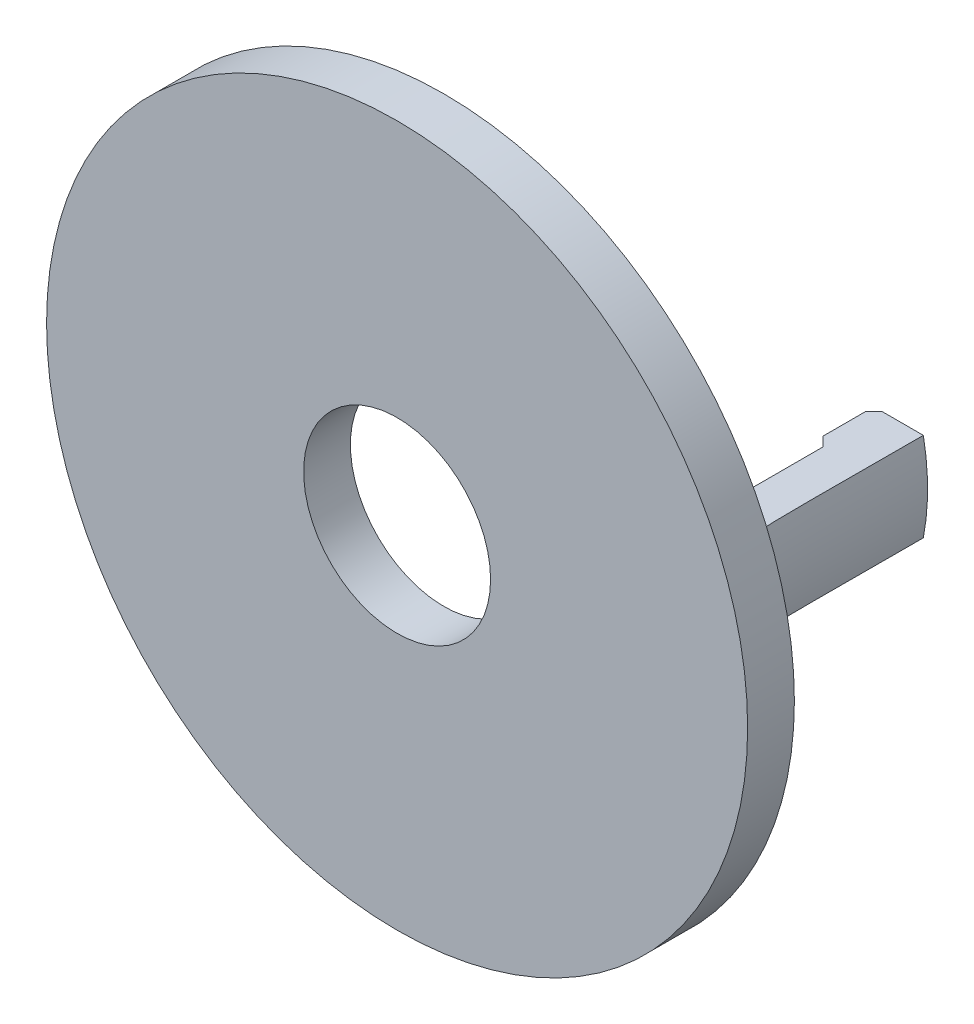
from build123d import *

# Parameters (mm, degrees)
SKETCH4_R           = 37.5
BOSS_EXTRUDE2_DEPTH = 5
SKETCH5_R           = 10
CUT_EXTRUDE1_DEPTH  = 54.268189382
BOSS_EXTRUDE3_DEPTH = 4.75
SKETCH1_R           = 37.5
CUT_EXTRUDE2_DEPTH  = 60.397495738


with BuildPart() as part:
    # Sketch4 → Boss-Extrude2 (new body)
    with BuildSketch(Plane.XY):
        Circle(SKETCH4_R)
    extrude(amount=BOSS_EXTRUDE2_DEPTH)

    # Sketch5 → Cut-Extrude1 (cut, through all)
    with BuildSketch(Plane.XY.offset(5)):
        Circle(SKETCH5_R)
    extrude(amount=-CUT_EXTRUDE1_DEPTH, mode=Mode.SUBTRACT)

    # Sketch6 → Boss-Extrude3 (add, symmetric)
    with BuildSketch(Plane(origin=(0, 0, 0), x_dir=(1, 0, 0), z_dir=(0, 1, 0))):
        Polygon((20.25, 2.896446609), (17.353553391, 0), (26.5, 0), (26.5, 26.75), (20.103553391, 26.75), (19.25, 25.896446609), (19.25, 21.310660172), (20.25, 20.310660172), align=None)
    boss_extrude3 = extrude(amount=BOSS_EXTRUDE3_DEPTH, both=True)

    # Sketch1 → Cut-Extrude2 (cut, through all)
    with BuildSketch(Plane.XY):
        Circle(SKETCH1_R)
        with BuildLine():
            ThreePointArc((-1, 26.481125354), (18.381376445, 19.088609169), (26.5, 0))
            ThreePointArc((26.5, 0), (18.381376445, -19.088609169), (-1, -26.481125354))
            ThreePointArc((-1, -26.481125354), (-28.5, 0), (-1, 26.481125354))
        make_face(mode=Mode.SUBTRACT)
    cut_extrude2 = extrude(amount=-CUT_EXTRUDE2_DEPTH, mode=Mode.SUBTRACT)

    # Sketch6<4> → Cut-Revolve1 (revolve, cut)
    with BuildSketch(Plane(origin=(0, 0, 0), x_dir=(1, 0, 0), z_dir=(0, 1, 0))):
        with BuildLine():
            add(Edge.make_bspline(
                [(25, 26.75), (25, 22.72818992), (24.990050178, 20.542467854), (25.01194908, 14.942357728), (24.774871471, 4.983935506), (26.5, 0)],
                knots=[0, 0, 0, 0, 0.44660472, 0.54660472, 1, 1, 1, 1], degree=3))
            Line((26.5, 0), (26.5, 26.75))
            Line((26.5, 26.75), (25, 26.75))
        make_face()
    cut_revolve1 = revolve(axis=Axis((0, 0, 0), (0, 0, -1)), mode=Mode.SUBTRACT)

    # Mirror1: Boss-Extrude3, Cut-Extrude2, Cut-Revolve1 across plane
    add(boss_extrude3.mirror(Plane(origin=(0, 0, 0), x_dir=(0, 0, 1), z_dir=(1, 0, 0))))
    add(cut_extrude2.mirror(Plane(origin=(0, 0, 0), x_dir=(0, 0, 1), z_dir=(1, 0, 0))), mode=Mode.SUBTRACT)
    add(cut_revolve1.mirror(Plane(origin=(0, 0, 0), x_dir=(0, 0, 1), z_dir=(1, 0, 0))), mode=Mode.SUBTRACT)


solid = part.part
